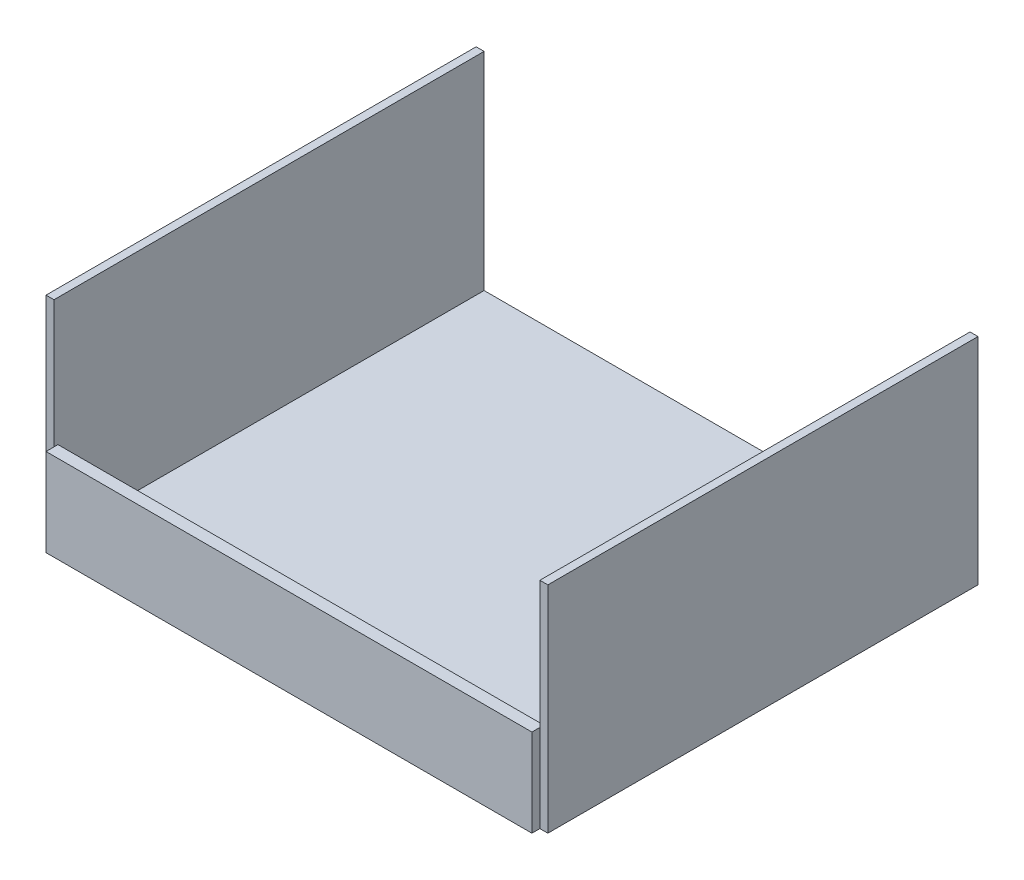
from build123d import *

# Parameters (mm, degrees)
SKETCH2_W            = 200.025
SKETCH2_H            = 171.45
BOSS_EXTRUDE1_DEPTH  = 3.175
SKETCH3_W            = 3.175
SKETCH3_H            = 171.45
BOSS_EXTRUDE2_DEPTH  = 82.55
SKETCH6_W            = 193.675
SKETCH6_H            = 21.624138411
BOSS_EXTRUDE13_DEPTH = 3.175
SKETCH7_W            = 193.675
SKETCH7_H            = 4.7625
BOSS_EXTRUDE23_DEPTH = 31.75


with BuildPart() as part:
    # Sketch2 → Boss-Extrude1 (new body)
    with BuildSketch(Plane(origin=(0, 0, 0), x_dir=(1, 0, 0), z_dir=(0, 1, 0))):
        with Locations((-11.312041544, 44.007841651)):
            Rectangle(SKETCH2_W, SKETCH2_H)
    extrude(amount=BOSS_EXTRUDE1_DEPTH)

    # Sketch3 → Boss-Extrude2 (add)
    with BuildSketch(Plane(origin=(0, 3.175, 0), x_dir=(1, 0, 0), z_dir=(0, 1, 0))):
        with Locations((-109.737041544, 44.007841651)):
            Rectangle(SKETCH3_W, SKETCH3_H)
        with Locations((87.112958456, 44.007841651)):
            Rectangle(SKETCH3_W, SKETCH3_H)
    extrude(amount=BOSS_EXTRUDE2_DEPTH)

    # Sketch6 → Boss-Extrude13 (add)
    with BuildSketch(Plane.XZ):
        with Locations((-11.312041544, 34.080089144)):
            Rectangle(SKETCH6_W, SKETCH6_H)
    extrude(amount=-BOSS_EXTRUDE13_DEPTH)

    # Sketch7 → Boss-Extrude23 (add)
    with BuildSketch(Plane(origin=(0, 3.175, 0), x_dir=(1, 0, 0), z_dir=(0, 1, 0))):
        with Locations((-11.312041544, -42.510908349)):
            Rectangle(SKETCH7_W, SKETCH7_H)
    extrude(amount=BOSS_EXTRUDE23_DEPTH)


solid = part.part
